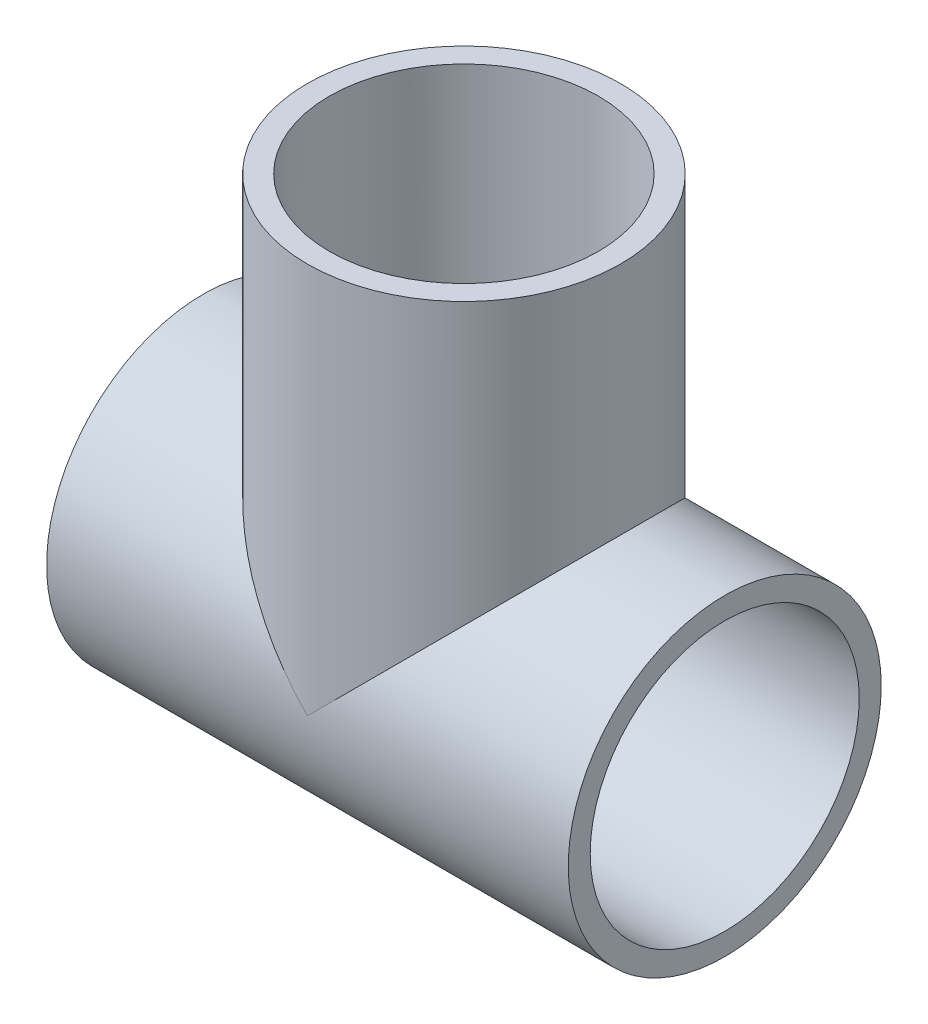
from build123d import *

# Parameters (mm, degrees)
SKETCH1_R           = 7.62
BOSS_EXTRUDE1_DEPTH = 25.4
SKETCH2_R           = 7.62
BOSS_EXTRUDE2_DEPTH = 19.05
SKETCH3_R           = 6.55
CUT_EXTRUDE1_DEPTH  = 33.651598736
CUT_EXTRUDE2_REACH  = 39.61
SKETCH4_R           = 6.55


with BuildPart() as part:
    # Sketch1 → Boss-Extrude1 (new body)
    with BuildSketch(Plane(origin=(0, 0, 0), x_dir=(0, 0, -1), z_dir=(1, 0, 0))):
        Circle(SKETCH1_R)
    extrude(amount=BOSS_EXTRUDE1_DEPTH)

    # Sketch2 → Boss-Extrude2 (add)
    with BuildSketch(Plane(origin=(0, 0, 0), x_dir=(1, 0, 0), z_dir=(0, 1, 0))):
        with Locations((12.7, 0)):
            Circle(SKETCH2_R)
    extrude(amount=BOSS_EXTRUDE2_DEPTH)

    # Sketch3 → Cut-Extrude1 (cut, through all)
    with BuildSketch(Plane(origin=(25.4, 0, 0), x_dir=(0, 0, -1), z_dir=(1, 0, 0))):
        Circle(SKETCH3_R)
    extrude(amount=-CUT_EXTRUDE1_DEPTH, mode=Mode.SUBTRACT)

    # Sketch4 → Cut-Extrude2 (cut, up to next)
    with BuildSketch(Plane(origin=(0, 19.05, 0), x_dir=(1, 0, 0), z_dir=(0, 1, 0)), mode=Mode.PRIVATE) as cut_extrude2_sk1:
        with Locations((12.7, 0)):
            Circle(SKETCH4_R)
    cut_extrude2_tool1 = extrude(cut_extrude2_sk1.sketch, amount=-CUT_EXTRUDE2_REACH, mode=Mode.PRIVATE) & part.part
    add(cut_extrude2_tool1.solids().sort_by_distance((12.7, 19.05, 0))[0], mode=Mode.SUBTRACT)


solid = part.part
